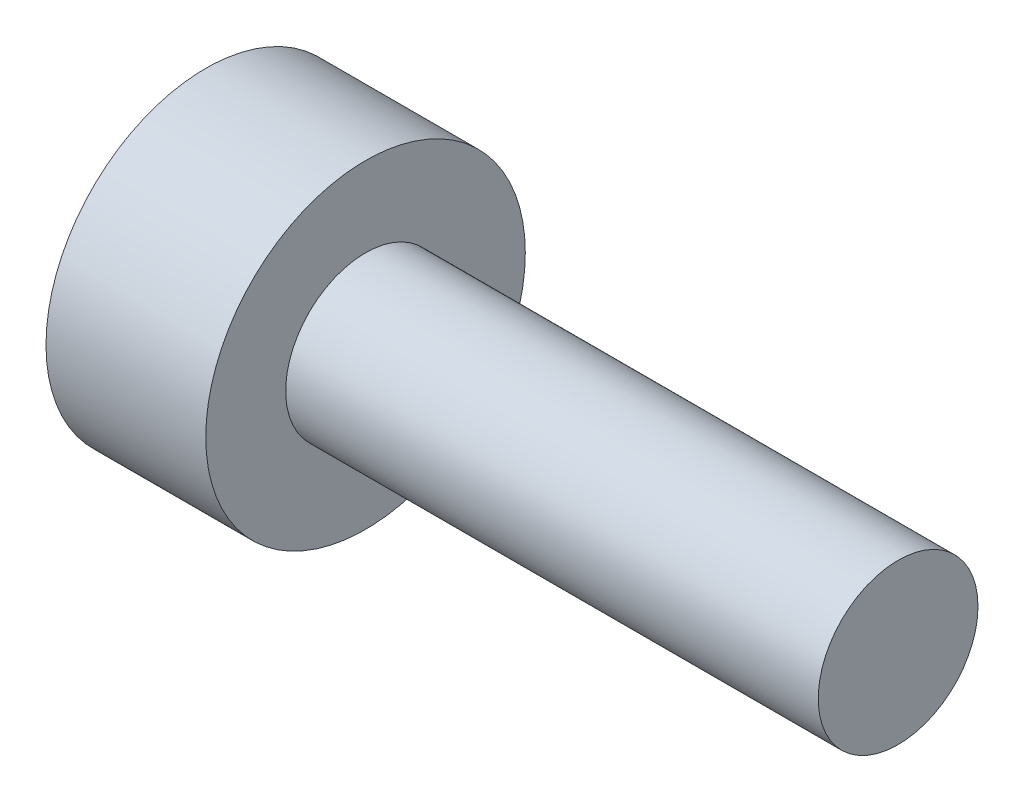
from build123d import *

# Parameters (mm, degrees)
SKETCH1_R           = 3
BOSS_EXTRUDE1_DEPTH = 3
SKETCH2_R           = 1.5
BOSS_EXTRUDE2_DEPTH = 10


with BuildPart() as part:
    # Sketch1 → Boss-Extrude1 (new body)
    with BuildSketch(Plane(origin=(0, 0, 0), x_dir=(0, 0, -1), z_dir=(1, 0, 0))):
        Circle(SKETCH1_R)
    extrude(amount=BOSS_EXTRUDE1_DEPTH)

    # Sketch2 → Boss-Extrude2 (add)
    with BuildSketch(Plane(origin=(3, 0, 0), x_dir=(0, 0, -1), z_dir=(1, 0, 0))):
        Circle(SKETCH2_R)
    extrude(amount=BOSS_EXTRUDE2_DEPTH)


solid = part.part
